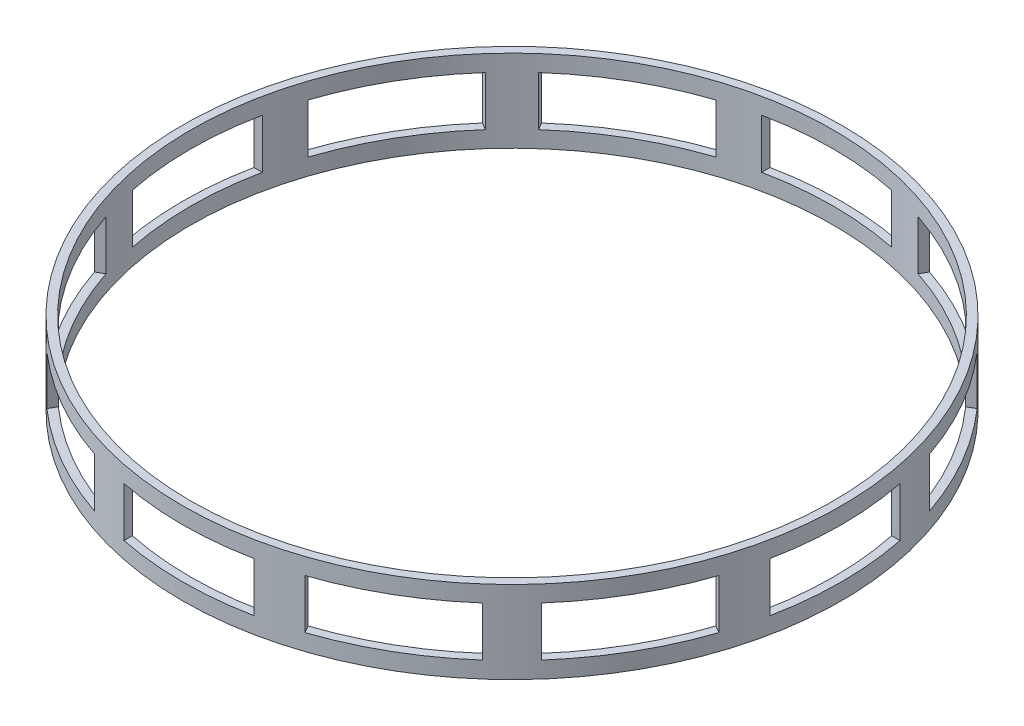
from build123d import *

# Parameters (mm, degrees)
SKETCH1_R           = 100
SKETCH1_R_2         = 97.5
BOSS_EXTRUDE1_DEPTH = 25
SKETCH2_W           = 25
SKETCH2_H           = 15
CUT_EXTRUDE1_DEPTH  = 144.614066163
CIRPATTERN1_COUNT   = 12


with BuildPart() as part:
    # Sketch1 → Boss-Extrude1 (new body)
    with BuildSketch(Plane(origin=(0, 0, 0), x_dir=(1, 0, 0), z_dir=(0, 1, 0))):
        Circle(SKETCH1_R)
        Circle(SKETCH1_R_2, mode=Mode.SUBTRACT)
    extrude(amount=BOSS_EXTRUDE1_DEPTH)

    # Sketch2 → Cut-Extrude1 (cut, symmetric)
    with BuildSketch(Plane.XY):
        with Locations((7.208969249, 12.5)):
            Rectangle(SKETCH2_W, SKETCH2_H)
    cut_extrude1 = extrude(amount=CUT_EXTRUDE1_DEPTH, both=True, mode=Mode.SUBTRACT)

    # CirPattern1: Cut-Extrude1 ×12 about axis
    cirpattern1_axis = Axis((0, 25, 0), (0, -1, 0))
    for i in range(1, CIRPATTERN1_COUNT):
        add(cut_extrude1.rotate(cirpattern1_axis, i * 360 / CIRPATTERN1_COUNT), mode=Mode.SUBTRACT)


solid = part.part
